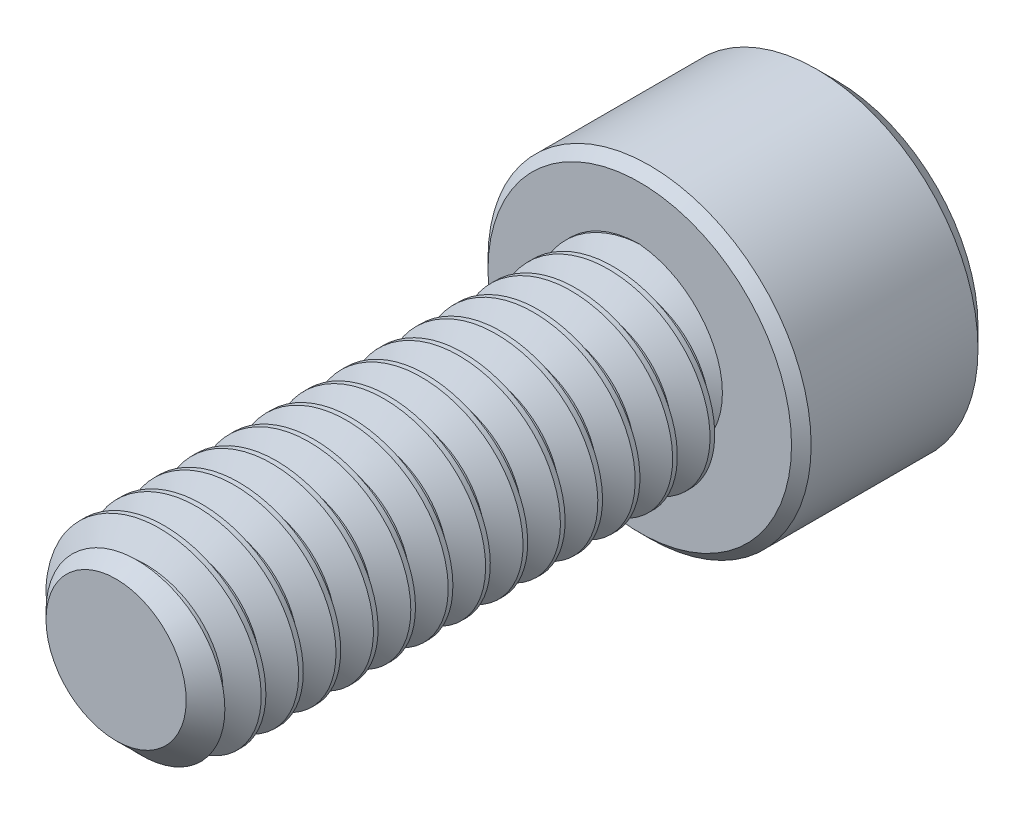
from build123d import *

# Parameters (mm, degrees)
SKETCH1_R          = 2.0828
EXTRUDE1_DEPTH     = 11.1125
CHAMFER3_SIZE      = 0.5953125
CUT_SWEEP1_PITCH   = 0.79375
SKETCH6_R          = 3.429
EXTRUDE2_DEPTH     = 4.1656
CUT_EXTRUDE1_DEPTH = 2.67890625
SKETCH8_R          = 2.062222993
CUT_EXTRUDE2_DEPTH = 0.41656
CUT_EXTRUDE2_DRAFT = -45
CHAMFER1_SIZE      = 0.41656
CHAMFER2_SIZE      = 0.20828


with BuildPart() as part:
    # Sketch1 → Extrude1 (new body)
    with BuildSketch(Plane.XY):
        Circle(SKETCH1_R)
    extrude(amount=-EXTRUDE1_DEPTH)

    # Chamfer3
    chamfer3_edges = [part.edges().sort_by_distance(p)[0] for p in [
        (-2.0828, 0, 0),
    ]]
    chamfer(chamfer3_edges, length=CHAMFER3_SIZE)

    # Cut-Sweep1: the profile of Sketch3 profile screwed along a right-hand helix of 15 turns, 6 arcs to a turn; built about Z, then put on its axis
    cut_sweep1_z = Axis((0, 0, 0), (0, 0, 1))
    cut_sweep1_corners = [(2.0831, 0, -0.694704455), (1.567244252, 0, -0.396875), (1.567244252, 0, -0.29765625), (2.0831, 0, 0.000173205)]
    with BuildLine(mode=Mode.PRIVATE) as cut_sweep1_profile:
        Line(cut_sweep1_corners[0], cut_sweep1_corners[1])
        Line(cut_sweep1_corners[1], cut_sweep1_corners[2])
        Line(cut_sweep1_corners[2], cut_sweep1_corners[3])
        Line(cut_sweep1_corners[3], cut_sweep1_corners[0])
    cut_sweep1_cap = Face(cut_sweep1_profile.wire())
    cut_sweep1_turn_angles = [0, 30, 60, 90, 120, 150, 180, 210, 240, 270, 300, 330, 360]
    cut_sweep1_turn_weights = [1, 0.8660254037844387, 1, 0.8660254037844387, 1, 0.8660254037844387, 1, 0.8660254037844387, 1, 0.8660254037844387, 1, 0.8660254037844387, 1]
    cut_sweep1_turn_rails = [Edge.make_bspline([Vector(p[0], p[1], 0).rotate(cut_sweep1_z, cut_sweep1_turn_angles[k]) / cut_sweep1_turn_weights[k] + Vector(0, 0, p[2] + CUT_SWEEP1_PITCH * cut_sweep1_turn_angles[k] / 360) for k in range(13)], [0, 0, 0, 1, 1, 2, 2, 3, 3, 4, 4, 5, 5, 6, 6, 6], 2, cut_sweep1_turn_weights) for p in cut_sweep1_corners]
    cut_sweep1_turn_sides = [Face.make_surface_from_curves(cut_sweep1_turn_rails[p[0]], cut_sweep1_turn_rails[p[1]]) for p in [(0, 1), (1, 2), (2, 3), (3, 0)]]
    cut_sweep1 = Plane(origin=(0, 0, 0), x_dir=(0, 1, 0), z_dir=(0, 0, -1)) * Solid(Shell([*[p.moved(Location((0, 0, CUT_SWEEP1_PITCH * i))) for i in range(15) for p in cut_sweep1_turn_sides], cut_sweep1_cap, cut_sweep1_cap.rotate(cut_sweep1_z, 5400).moved(Location((0, 0, CUT_SWEEP1_PITCH * 5400 / 360)))]))
    add(cut_sweep1, mode=Mode.SUBTRACT)

    # Sketch6 → Extrude2 (add)
    with BuildSketch(Plane(origin=(0, 0, -11.1125), x_dir=(-1, 0, 0), z_dir=(0, 0, -1))):
        Circle(SKETCH6_R)
    extrude(amount=EXTRUDE2_DEPTH)

    # Sketch7 → Cut-Extrude1 (cut)
    with BuildSketch(Plane(origin=(0, 0, -15.2781), x_dir=(-1, 0, 0), z_dir=(0, 0, -1))):
        Polygon((0, 2.062222993), (-1.7859375, 1.031111496), (-1.7859375, -1.031111496), (0, -2.062222993), (1.7859375, -1.031111496), (1.7859375, 1.031111496), align=None)
    extrude(amount=-CUT_EXTRUDE1_DEPTH, mode=Mode.SUBTRACT)


with BuildPart() as cut_extrude2_tool:
    # Sketch8 → Cut-Extrude2 (with draft: the straight prism first)
    with BuildSketch(Plane(origin=(0, 0, -15.2781), x_dir=(-1, 0, 0), z_dir=(0, 0, -1))):
        Circle(SKETCH8_R)
    extrude(amount=-CUT_EXTRUDE2_DEPTH)
    # Cut-Extrude2: the draft: its side faces are tilted about the plane it starts from
    cut_extrude2_sides = [cut_extrude2_tool.faces().sort_by_distance(p)[0] for p in [
        (2.062222993, 0, -15.06982),
    ]]
    draft(cut_extrude2_sides, Plane(origin=(0, 0, -15.2781), x_dir=(-1, 0, 0), z_dir=(0, 0, -1)), CUT_EXTRUDE2_DRAFT)


with BuildPart() as part_1:
    add(part.part)

    # Cut-Extrude2: cut by cut_extrude2_tool
    add(cut_extrude2_tool.part, mode=Mode.SUBTRACT)

    # Chamfer1
    chamfer1_edges = [part_1.edges().sort_by_distance(p)[0] for p in [
        (3.429, 0, -15.2781),
    ]]
    chamfer(chamfer1_edges, length=CHAMFER1_SIZE)

    # Chamfer2
    chamfer2_edges = [part_1.edges().sort_by_distance(p)[0] for p in [
        (3.429, 0, -11.1125),
    ]]
    chamfer(chamfer2_edges, length=CHAMFER2_SIZE)


solid = part_1.part
